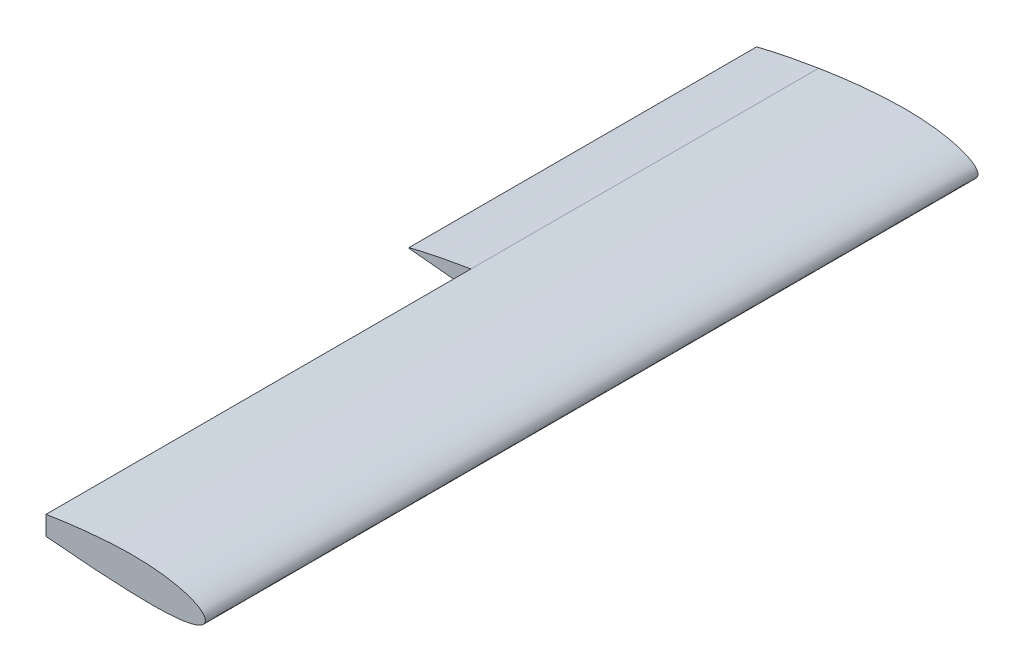
from build123d import *

# Parameters (mm, degrees)
BOSS_EXTRUDE1_DEPTH = 1120
BOSS_EXTRUDE2_DEPTH = 504
SKETCH3_R           = 12.7
CUT_EXTRUDE1_DEPTH  = 801
SKETCH4_W           = 32
SKETCH4_H           = 40.764
CUT_EXTRUDE2_DEPTH  = 46
SKETCH5_W           = 60
SKETCH5_H           = 12
CUT_EXTRUDE3_DEPTH  = 46
SKETCH6_W           = 54
SKETCH6_H           = 29.1
CUT_EXTRUDE4_DEPTH  = 64
SKETCH7_W           = 20.4
SKETCH7_H           = 6.8
CUT_EXTRUDE5_DEPTH  = 26


with BuildPart() as part:
    # Sketch1 → Boss-Extrude1 (new body)
    with BuildSketch(Plane.XY):
        with BuildLine():
            Line((-230.9508, 18.549655218), (-230.9508, -9.254301498))
            add(Edge.make_bspline(
                [(-230.9508, 18.549655218), (-228.049495749, 19.012199792), (-221.209790862, 20.102629511), (-210.309484015, 21.694228457), (-198.177918873, 23.344790405), (-185.801278857, 24.876155415), (-173.257128714, 26.267978143), (-160.623441873, 27.493783455), (-147.979456839, 28.530532604), (-135.38680304, 29.355171085), (-122.901523706, 29.953954368), (-110.600645828, 30.233245093), (-98.584530722, 30.190184092), (-86.956752113, 29.818162025), (-75.795476598, 29.120192561), (-65.175571702, 28.104733617), (-55.167884393, 26.786610347), (-45.83844827, 25.186431442), (-37.247767676, 23.330020663), (-29.450147797, 21.247475272), (-22.49306267, 18.971935561), (-16.416484661, 16.538049824), (-11.25212628, 13.979857249), (-7.022410883, 11.327945562), (-3.740398213, 8.603289627), (-1.414154387, 5.809331387), (-0.076147693, 2.919702269), (0.174499495, -0.017526218), (-0.651971008, -2.844649473), (-2.518378552, -5.413150636), (-5.310866411, -7.706234175), (-8.995972622, -9.76681916), (-13.558597282, -11.608009751), (-18.977523447, -13.230313942), (-25.223163569, -14.62951684), (-32.259081774, -15.801834128), (-40.043593034, -16.745705279), (-48.530826795, -17.462895097), (-57.671430551, -17.959035884), (-67.413025894, -18.243888192), (-77.700502564, -18.331295899), (-88.476207861, -18.238956627), (-99.680049498, -17.987646529), (-111.249637369, -17.601440252), (-123.143365035, -17.102105049), (-135.312062781, -16.52328547), (-147.680909126, -15.81306962), (-160.152760479, -15.001217792), (-172.634499225, -14.108952492), (-185.050601402, -13.157538897), (-197.325497399, -12.166288956), (-209.383936099, -11.151676018), (-220.568663804, -10.182660427), (-227.724671483, -9.542778278), (-230.9508, -9.254301498)],
                knots=[0, 0, 0, 0, 0.018424224, 0.043434346, 0.069080412, 0.095203092, 0.121640117, 0.148227444, 0.17480049, 0.201195447, 0.227363977, 0.253181792, 0.278347264, 0.302710399, 0.326128333, 0.348466602, 0.369600377, 0.389415723, 0.407811011, 0.424698681, 0.44000774, 0.453687637, 0.465714725, 0.476103672, 0.484928355, 0.492360154, 0.498730164, 0.504586951, 0.510443348, 0.516803825, 0.524198712, 0.532940661, 0.543185695, 0.554995644, 0.568376342, 0.583298542, 0.599709376, 0.617538825, 0.636703502, 0.65710892, 0.678650912, 0.701216586, 0.724685048, 0.748928058, 0.7738107, 0.799337901, 0.825325561, 0.851504471, 0.877716004, 0.903800001, 0.929595993, 0.954944401, 0.979687675, 1, 1, 1, 1], degree=3))
        make_face()
    extrude(amount=BOSS_EXTRUDE1_DEPTH)

    # Sketch2 → Boss-Extrude2 (add)
    with BuildSketch(Plane.XY):
        with BuildLine():
            Line((-230.9508, 18.549655218), (-230.9508, -9.254301498))
            add(Edge.make_bspline(
                [(-230.9508, -9.254301498), (-231.533938961, -9.202472505), (-235.781981249, -8.824909402), (-243.525519749, -8.116106578), (-253.99195523, -7.147735043), (-263.888990978, -6.21441807), (-273.154181285, -5.326926332), (-281.728489584, -4.492561844), (-289.557033271, -3.718989784), (-296.589424989, -3.013864374), (-302.780100501, -2.383682661), (-308.088897629, -1.837830718), (-312.480728812, -1.376034223), (-315.927726107, -1.022678484), (-318.404741576, -0.737439563), (-319.900347138, -0.617044832), (-320.574918687, -0.50340935), (-320.753795962, -0.504046046), (-320.765, -0.504085926)],
                knots=[0, 0, 0, 0, 0.019462551, 0.14178051, 0.258505433, 0.368899529, 0.472261554, 0.567931303, 0.655293986, 0.733784513, 0.802891701, 0.862162346, 0.911205133, 0.949694244, 0.977372582, 0.994054454, 0.999627599, 1, 1, 1, 1], degree=3))
            Line((-320.765, -0.504085926), (-320.765, 0.512293238))
            add(Edge.make_bspline(
                [(-230.9508, 18.549655218), (-231.863681823, 18.40666283), (-236.443645159, 17.6892645), (-244.502692973, 16.318954112), (-254.935539903, 14.478856331), (-264.776208941, 12.646572101), (-273.967279049, 10.858775003), (-282.453535586, 9.139217922), (-290.184780464, 7.514403405), (-297.115470217, 6.0093973), (-303.205072904, 4.648335665), (-308.418205118, 3.453718496), (-312.724764914, 2.445888562), (-316.100039765, 1.642515188), (-318.524733585, 1.057899145), (-319.973889731, 0.705575825), (-320.613290589, 0.549358599), (-320.765, 0.512293238)],
                knots=[0, 0, 0, 0, 0.030251696, 0.151773928, 0.267626296, 0.377089872, 0.479484952, 0.574174897, 0.660569789, 0.738129949, 0.806369318, 0.864858701, 0.913228834, 0.951173208, 0.978450569, 0.994887008, 1, 1, 1, 1], degree=3))
        make_face()
    extrude(amount=BOSS_EXTRUDE2_DEPTH)

    # Sketch3 → Cut-Extrude1 (cut)
    with BuildSketch(Plane.XY):
        with Locations((-96.23, 6.014)):
            Circle(SKETCH3_R)
    extrude(amount=CUT_EXTRUDE1_DEPTH, mode=Mode.SUBTRACT)

    # Sketch4 → Cut-Extrude2 (cut)
    with BuildSketch(Plane.XY.offset(330.7)):
        with Locations((-96.23, 1.332)):
            Rectangle(SKETCH4_W, SKETCH4_H)
    extrude(amount=CUT_EXTRUDE2_DEPTH, mode=Mode.SUBTRACT)

    # Sketch5 → Cut-Extrude3 (cut)
    with BuildSketch(Plane.XY.offset(330.7)):
        with Locations((-256.612, -2.954)):
            Rectangle(SKETCH5_W, SKETCH5_H)
    extrude(amount=CUT_EXTRUDE3_DEPTH, mode=Mode.SUBTRACT)

    # Sketch6 → Cut-Extrude4 (cut)
    with BuildSketch(Plane.XY.offset(534.5)):
        with Locations((-176.421, -2.293)):
            Rectangle(SKETCH6_W, SKETCH6_H)
    extrude(amount=CUT_EXTRUDE4_DEPTH, mode=Mode.SUBTRACT)

    # Sketch7 → Cut-Extrude5 (cut)
    with BuildSketch(Plane.XY.offset(-0.5)):
        with Locations((-224.536, 4.811)):
            Rectangle(SKETCH7_W, SKETCH7_H)
    extrude(amount=CUT_EXTRUDE5_DEPTH, mode=Mode.SUBTRACT)


solid = part.part
